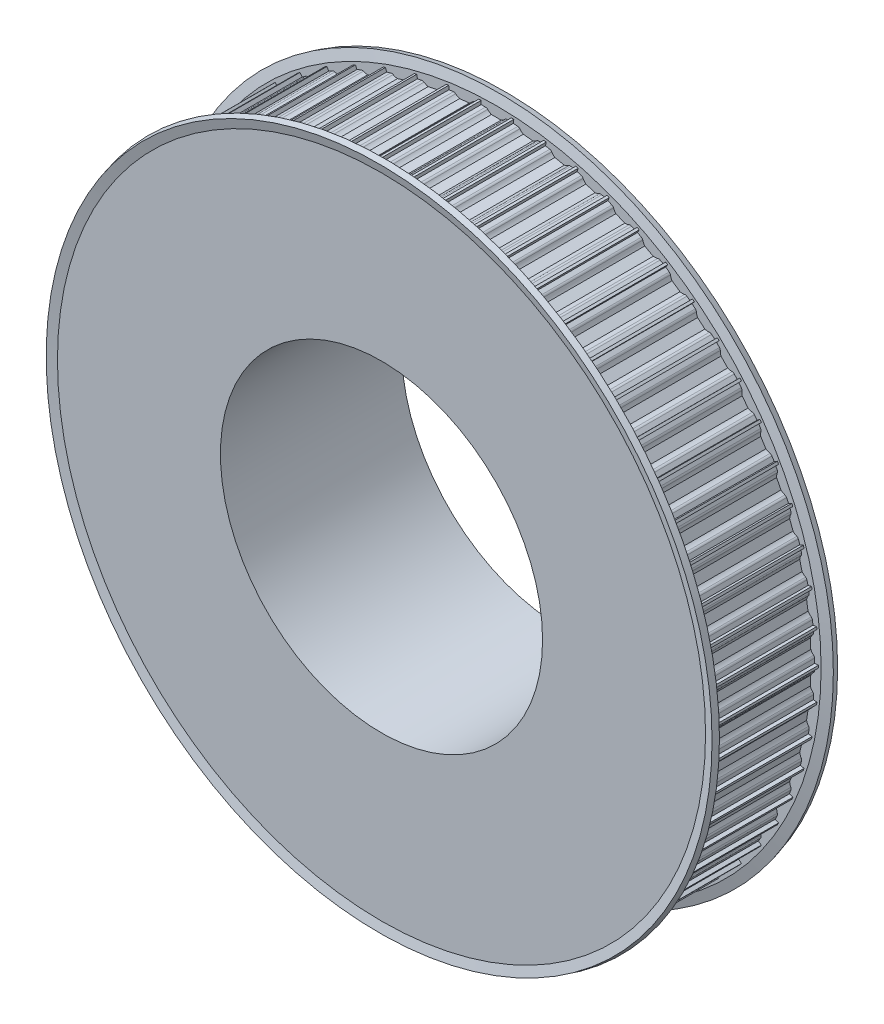
from build123d import *

# Parameters (mm, degrees)
CUT_EXTRUDE1_DEPTH = 122.757956619
CIRPATTERN1_COUNT  = 62


with BuildPart() as part:
    # Sketch1 → Revolve1 (revolve)
    with BuildSketch(Plane(origin=(0, 0, 0), x_dir=(0, 0, -1), z_dir=(1, 0, 0))):
        Polygon((0, 40), (0, 80), (30, 80), (30, 55.5), (45, 55.5), (45, 40), align=None)
    revolve(axis=Axis((0, 0, 55), (0, 0, -1)))

    # Sketch2 → Cut-Extrude1 (cut, through all)
    with BuildSketch(Plane.XY):
        with BuildLine():
            Line((2.664918486, 79), (3.75, 79))
            Line((3.75, 79), (3.75, 81))
            Line((3.75, 81), (-3.75, 81))
            Line((-3.75, 81), (-3.75, 79))
            Line((-3.75, 79), (-2.664918486, 79))
            ThreePointArc((-2.664918486, 79), (-2.376168895, 78.9421876), (-2.131934789, 78.77766313))
            ThreePointArc((-2.131934789, 78.77766313), (-1.695848695, 78.413624313), (-1.198957881, 78.138315649))
            Line((-1.198957881, 78.138315649), (1.198957881, 78.138315649))
            ThreePointArc((1.198957881, 78.138315649), (1.695848695, 78.413624313), (2.131934789, 78.77766313))
            ThreePointArc((2.131934789, 78.77766313), (2.376168895, 78.9421876), (2.664918486, 79))
        make_face()
    cut_extrude1 = extrude(amount=-CUT_EXTRUDE1_DEPTH, mode=Mode.SUBTRACT)

    # CirPattern1: Cut-Extrude1 ×62 about axis
    cirpattern1_axis = Axis((0, 0, 55), (0, 0, -1))
    for i in range(1, CIRPATTERN1_COUNT):
        add(cut_extrude1.rotate(cirpattern1_axis, i * 360 / CIRPATTERN1_COUNT), mode=Mode.SUBTRACT)

    # Sketch3 → Revolve2 (revolve)
    with BuildSketch(Plane(origin=(0, 0, 0), x_dir=(0, 0, -1), z_dir=(1, 0, 0))):
        Polygon((0, 80.467385881), (0, 75.664864627), (1.5, 75.664864627), (1.5, 80.664864627), (0.856921938, 83.064864627), (-0.591966801, 82.67663606), align=None)
        Polygon((30.591966801, 82.67663606), (29.143078062, 83.064864627), (28.5, 80.664864627), (28.5, 75.664864627), (30, 75.664864627), (30, 80.467385881), align=None)
    revolve(axis=Axis((0, 0, 55), (0, 0, -1)))


solid = part.part
